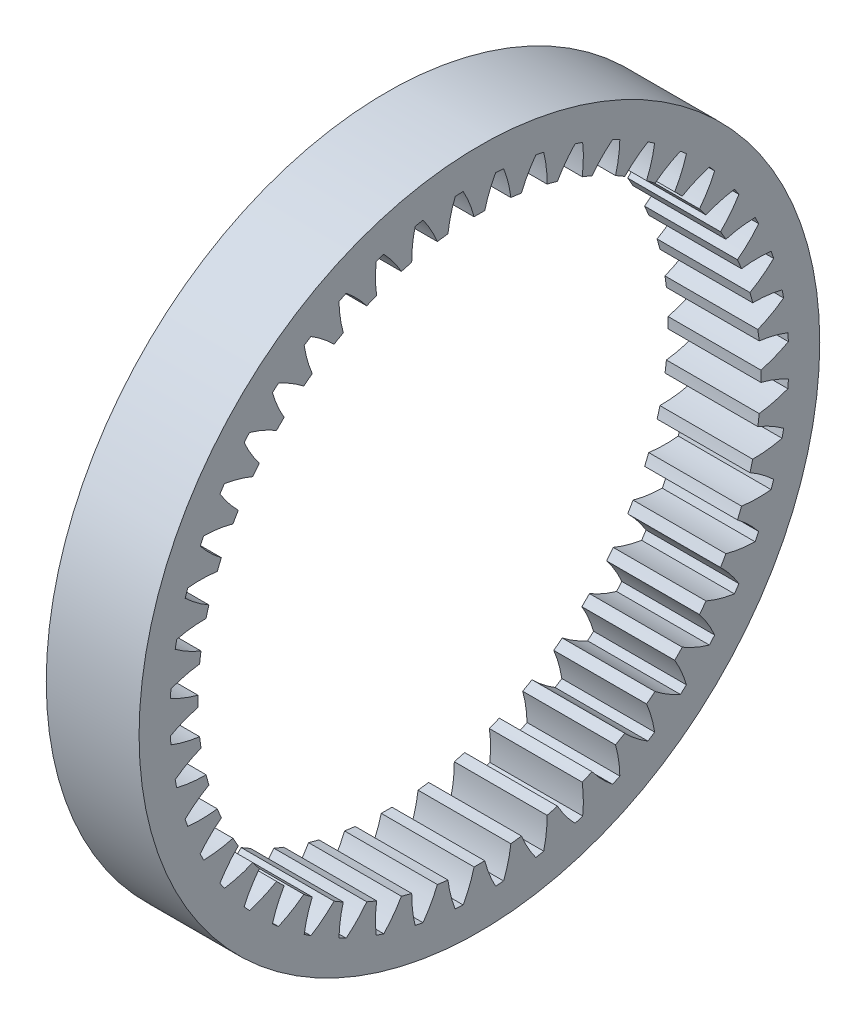
from build123d import *

# Parameters (mm, degrees)
BASPROSKE_W         = 16
BASPROSKE_H         = 50
TOOTHCUT_DEPTH      = 73.498275842
TEETHCUTS_COUNT     = 48
TEETHCUTS_ANGLE     = 352.5
HUBNEABOTSKE_R      = 7.5
HUBNEARBOTH_DEPTH   = 5.5000254
HUBFAR_START        = 5.5000254
HUBFARSKE_R         = 7.5
HUBFAR_DEPTH        = 5.5000254
BORSKE_R            = 5
BORE_DEPTH          = 27.0000508
SKETCH1_R           = 55
BOSS_EXTRUDE1_DEPTH = 15
COMBINE1_START      = -5.5000254
COMBINE1_DEPTH      = 27.0000508


# Read off the part's stored shape, not the designer's step: Combine1
with BuildPart() as part:
    # BasProSke → Base-Revolve (revolve)
    with BuildSketch(Plane(origin=(0, 0, 0), x_dir=(1, 0, 0), z_dir=(0, 1, 0)), mode=Mode.PRIVATE) as base_revolve_sk:
        with Locations((8, 25)):
            Rectangle(BASPROSKE_W, BASPROSKE_H)
    revolve(base_revolve_sk.sketch.rotate(Axis((-10, 0, 0), (1, 0, 0)), 180), axis=Axis((-10, 0, 0), (1, 0, 0)))

    # TooCutSke → ToothCut (cut, through all)
    with BuildSketch(Plane(origin=(0, 0, 0), x_dir=(0, 0, -1), z_dir=(1, 0, 0))):
        with BuildLine():
            ThreePointArc((0.864362355, 45.490788944), (0, 45.499), (-0.864362355, 45.490788944))
            ThreePointArc((-0.864362355, 45.490788944), (-1.610592674, 47.778981572), (-2.637230485, 49.955837102))
            ThreePointArc((-2.637230485, 49.955837102), (0, 50.0254), (2.637230485, 49.955837102))
            ThreePointArc((2.637230485, 49.955837102), (1.610592674, 47.778981572), (0.864362355, 45.490788944))
        make_face()
    toothcut = extrude(amount=TOOTHCUT_DEPTH, mode=Mode.SUBTRACT)

    # TeethCuts: ToothCut ×48 about axis
    teethcuts_axis = Axis((-10, 0, 0), (1, 0, 0))
    for i in range(1, TEETHCUTS_COUNT):
        add(toothcut.rotate(teethcuts_axis, i * TEETHCUTS_ANGLE / (TEETHCUTS_COUNT - 1)), mode=Mode.SUBTRACT)

    # HubNeaBotSke → HubNearBoth (add)
    with BuildSketch(Plane.ZY):
        with Locations(Location((0, 0, 0), (0, 0, 180))):
            Circle(HUBNEABOTSKE_R)
    extrude(amount=HUBNEARBOTH_DEPTH)

    # HubFarSke → HubFar (add)
    with BuildSketch(Plane(origin=(16, 0, 0), x_dir=(0, 0, -1), z_dir=(1, 0, 0)).offset(HUBFAR_START)):
        Circle(HUBFARSKE_R)
    extrude(amount=-HUBFAR_DEPTH)

    # BorSke → Bore (cut, symmetric)
    with BuildSketch(Plane(origin=(0, 0, 0), x_dir=(0, 0, -1), z_dir=(1, 0, 0))):
        with Locations(Location((0, 0, 0), (0, 0, 180))):
            Circle(BORSKE_R)
    extrude(amount=BORE_DEPTH, both=True, mode=Mode.SUBTRACT)


with BuildPart() as body_2:
    # Sketch1 → Boss-Extrude1 (new body)
    with BuildSketch(Plane(origin=(0, 0, 0), x_dir=(0, 0, -1), z_dir=(1, 0, 0))):
        Circle(SKETCH1_R)
    extrude(amount=BOSS_EXTRUDE1_DEPTH)


with BuildPart() as combine1_tool:
    # Combine1 outline → Combine1 (new body)
    with BuildSketch(Plane.YZ.offset(COMBINE1_START)):
        with BuildLine():
            ThreePointArc((3.916123788, 49.846403827), (3.270156461, 49.892946162), (2.623640481, 49.931117658))
            ThreePointArc((2.623640481, 49.931117658), (1.60539254, 47.765870759), (0.864362355, 45.490788944))
            ThreePointArc((0.864362355, 45.490788944), (0, 45.499), (-0.864362355, 45.490788944))
            ThreePointArc((-0.864362355, 45.490788944), (-1.60539254, 47.765870759), (-2.623640481, 49.931117658))
            ThreePointArc((-2.623640481, 49.931117658), (-3.270156461, 49.892946162), (-3.916123788, 49.846403827))
            ThreePointArc((-3.916123788, 49.846403827), (-4.643039044, 47.566772889), (-5.080771847, 45.214430865))
            ThreePointArc((-5.080771847, 45.214430865), (-5.93881122, 45.109749748), (-6.794707077, 44.988787011))
            ThreePointArc((-6.794707077, 44.988787011), (-7.826355412, 47.147681338), (-9.118513534, 49.161496223))
            ThreePointArc((-9.118513534, 49.161496223), (-9.754516101, 49.03926402), (-10.388882094, 48.908804206))
            ThreePointArc((-10.388882094, 48.908804206), (-10.812026943, 46.553794346), (-10.938972634, 44.164441338))
            ThreePointArc((-10.938972634, 44.164441338), (-11.776007733, 43.94865917), (-12.608792477, 43.71701446))
            ThreePointArc((-12.608792477, 43.71701446), (-13.913407174, 45.722782018), (-15.457366293, 47.550707958))
            ThreePointArc((-15.457366293, 47.550707958), (-16.071973265, 47.346506475), (-16.683883746, 47.134361385))
            ThreePointArc((-16.683883746, 47.134361385), (-16.796018063, 44.744267475), (-16.610004566, 42.358785976))
            ThreePointArc((-16.610004566, 42.358785976), (-17.411713489, 42.03559485), (-18.207137942, 41.69723167))
            ThreePointArc((-18.207137942, 41.69723167), (-19.762396681, 43.51555322), (-21.531739228, 45.126313896))
            ThreePointArc((-21.531739228, 45.126313896), (-22.114434511, 44.843637077), (-22.693419522, 44.553436572))
            ThreePointArc((-22.693419522, 44.553436572), (-22.492624657, 42.169153781), (-21.996834714, 39.828360041))
            ThreePointArc((-21.996834714, 39.828360041), (-22.7495, 39.403289847), (-23.493954229, 38.963997686))
            ThreePointArc((-23.493954229, 38.963997686), (-25.273246102, 40.563761242), (-27.237698136, 41.929796091))
            ThreePointArc((-27.237698136, 41.929796091), (-27.778511651, 41.573480615), (-28.314664599, 41.210190107))
            ThreePointArc((-28.314664599, 41.210190107), (-27.804376208, 38.872514175), (-27.007292923, 36.616459823))
            ThreePointArc((-27.007292923, 36.616459823), (-27.698036259, 36.09678363), (-28.378782446, 35.564078899))
            ThreePointArc((-28.378782446, 35.564078899), (-30.351663275, 36.917912062), (-32.477612477, 38.01584785))
            ThreePointArc((-32.477612477, 38.01584785), (-32.967290755, 37.591990374), (-33.451437913, 37.161825864))
            ThreePointArc((-33.451437913, 37.161825864), (-32.640387172, 34.910755075), (-31.555648861, 32.778041826))
            ThreePointArc((-31.555648861, 32.778041826), (-32.172651437, 32.172651437), (-32.778041826, 31.555648861))
            ThreePointArc((-32.778041826, 31.555648861), (-34.910755075, 32.640387172), (-37.161825864, 33.451437913))
            ThreePointArc((-37.161825864, 33.451437913), (-37.591990374, 32.967290755), (-38.01584785, 32.477612477))
            ThreePointArc((-38.01584785, 32.477612477), (-36.917912062, 30.351663275), (-35.564078899, 28.378782446))
            ThreePointArc((-35.564078899, 28.378782446), (-36.09678363, 27.698036259), (-36.616459823, 27.007292923))
            ThreePointArc((-36.616459823, 27.007292923), (-38.872514175, 27.804376208), (-41.210190107, 28.314664599))
            ThreePointArc((-41.210190107, 28.314664599), (-41.573480615, 27.778511651), (-41.929796091, 27.237698136))
            ThreePointArc((-41.929796091, 27.237698136), (-40.563761242, 25.273246102), (-38.963997686, 23.493954229))
            ThreePointArc((-38.963997686, 23.493954229), (-39.403289847, 22.7495), (-39.828360041, 21.996834714))
            ThreePointArc((-39.828360041, 21.996834714), (-42.169153781, 22.492624657), (-44.553436572, 22.693419522))
            ThreePointArc((-44.553436572, 22.693419522), (-44.843637077, 22.114434511), (-45.126313896, 21.531739228))
            ThreePointArc((-45.126313896, 21.531739228), (-43.51555322, 19.762396681), (-41.69723167, 18.207137942))
            ThreePointArc((-41.69723167, 18.207137942), (-42.03559485, 17.411713489), (-42.358785976, 16.610004566))
            ThreePointArc((-42.358785976, 16.610004566), (-44.744267475, 16.796018063), (-47.134361385, 16.683883746))
            ThreePointArc((-47.134361385, 16.683883746), (-47.346506475, 16.071973265), (-47.550707958, 15.457366293))
            ThreePointArc((-47.550707958, 15.457366293), (-45.722782018, 13.913407174), (-43.71701446, 12.608792477))
            ThreePointArc((-43.71701446, 12.608792477), (-43.94865917, 11.776007733), (-44.164441338, 10.938972634))
            ThreePointArc((-44.164441338, 10.938972634), (-46.553794346, 10.812026943), (-48.908804206, 10.388882094))
            ThreePointArc((-48.908804206, 10.388882094), (-49.03926402, 9.754516101), (-49.161496223, 9.118513534))
            ThreePointArc((-49.161496223, 9.118513534), (-47.147681338, 7.826355412), (-44.988787011, 6.794707077))
            ThreePointArc((-44.988787011, 6.794707077), (-45.109749748, 5.93881122), (-45.214430865, 5.080771847))
            ThreePointArc((-45.214430865, 5.080771847), (-47.566772889, 4.643039044), (-49.846403827, 3.916123788))
            ThreePointArc((-49.846403827, 3.916123788), (-49.892946162, 3.270156461), (-49.931117658, 2.623640481))
            ThreePointArc((-49.931117658, 2.623640481), (-47.765870759, 1.60539254), (-45.490788944, 0.864362355))
            ThreePointArc((-45.490788944, 0.864362355), (-45.499, 0), (-45.490788944, -0.864362355))
            ThreePointArc((-45.490788944, -0.864362355), (-47.765870759, -1.60539254), (-49.931117658, -2.623640481))
            ThreePointArc((-49.931117658, -2.623640481), (-49.892946162, -3.270156461), (-49.846403827, -3.916123788))
            ThreePointArc((-49.846403827, -3.916123788), (-47.566772889, -4.643039044), (-45.214430865, -5.080771847))
            ThreePointArc((-45.214430865, -5.080771847), (-45.109749748, -5.93881122), (-44.988787011, -6.794707077))
            ThreePointArc((-44.988787011, -6.794707077), (-47.147681338, -7.826355412), (-49.161496223, -9.118513534))
            ThreePointArc((-49.161496223, -9.118513534), (-49.03926402, -9.754516101), (-48.908804206, -10.388882094))
            ThreePointArc((-48.908804206, -10.388882094), (-46.553794346, -10.812026943), (-44.164441338, -10.938972634))
            ThreePointArc((-44.164441338, -10.938972634), (-43.94865917, -11.776007733), (-43.71701446, -12.608792477))
            ThreePointArc((-43.71701446, -12.608792477), (-45.722782018, -13.913407174), (-47.550707958, -15.457366293))
            ThreePointArc((-47.550707958, -15.457366293), (-47.346506475, -16.071973265), (-47.134361385, -16.683883746))
            ThreePointArc((-47.134361385, -16.683883746), (-44.744267475, -16.796018063), (-42.358785976, -16.610004566))
            ThreePointArc((-42.358785976, -16.610004566), (-42.03559485, -17.411713489), (-41.69723167, -18.207137942))
            ThreePointArc((-41.69723167, -18.207137942), (-43.51555322, -19.762396681), (-45.126313896, -21.531739228))
            ThreePointArc((-45.126313896, -21.531739228), (-44.843637077, -22.114434511), (-44.553436572, -22.693419522))
            ThreePointArc((-44.553436572, -22.693419522), (-42.169153781, -22.492624657), (-39.828360041, -21.996834714))
            ThreePointArc((-39.828360041, -21.996834714), (-39.403289847, -22.7495), (-38.963997686, -23.493954229))
            ThreePointArc((-38.963997686, -23.493954229), (-40.563761242, -25.273246102), (-41.929796091, -27.237698136))
            ThreePointArc((-41.929796091, -27.237698136), (-41.573480615, -27.778511651), (-41.210190107, -28.314664599))
            ThreePointArc((-41.210190107, -28.314664599), (-38.872514175, -27.804376208), (-36.616459823, -27.007292923))
            ThreePointArc((-36.616459823, -27.007292923), (-36.09678363, -27.698036259), (-35.564078899, -28.378782446))
            ThreePointArc((-35.564078899, -28.378782446), (-36.917912062, -30.351663275), (-38.01584785, -32.477612477))
            ThreePointArc((-38.01584785, -32.477612477), (-37.591990374, -32.967290755), (-37.161825864, -33.451437913))
            ThreePointArc((-37.161825864, -33.451437913), (-34.910755075, -32.640387172), (-32.778041826, -31.555648861))
            ThreePointArc((-32.778041826, -31.555648861), (-32.172651437, -32.172651437), (-31.555648861, -32.778041826))
            ThreePointArc((-31.555648861, -32.778041826), (-32.640387172, -34.910755075), (-33.451437913, -37.161825864))
            ThreePointArc((-33.451437913, -37.161825864), (-32.967290755, -37.591990374), (-32.477612477, -38.01584785))
            ThreePointArc((-32.477612477, -38.01584785), (-30.351663275, -36.917912062), (-28.378782446, -35.564078899))
            ThreePointArc((-28.378782446, -35.564078899), (-27.698036259, -36.09678363), (-27.007292923, -36.616459823))
            ThreePointArc((-27.007292923, -36.616459823), (-27.804376208, -38.872514175), (-28.314664599, -41.210190107))
            ThreePointArc((-28.314664599, -41.210190107), (-27.778511651, -41.573480615), (-27.237698136, -41.929796091))
            ThreePointArc((-27.237698136, -41.929796091), (-25.273246102, -40.563761242), (-23.493954229, -38.963997686))
            ThreePointArc((-23.493954229, -38.963997686), (-22.7495, -39.403289847), (-21.996834714, -39.828360041))
            ThreePointArc((-21.996834714, -39.828360041), (-22.492624657, -42.169153781), (-22.693419522, -44.553436572))
            ThreePointArc((-22.693419522, -44.553436572), (-22.114434511, -44.843637077), (-21.531739228, -45.126313896))
            ThreePointArc((-21.531739228, -45.126313896), (-19.762396681, -43.51555322), (-18.207137942, -41.69723167))
            ThreePointArc((-18.207137942, -41.69723167), (-17.411713489, -42.03559485), (-16.610004566, -42.358785976))
            ThreePointArc((-16.610004566, -42.358785976), (-16.796018063, -44.744267475), (-16.683883746, -47.134361385))
            ThreePointArc((-16.683883746, -47.134361385), (-16.071973265, -47.346506475), (-15.457366293, -47.550707958))
            ThreePointArc((-15.457366293, -47.550707958), (-13.913407174, -45.722782018), (-12.608792477, -43.71701446))
            ThreePointArc((-12.608792477, -43.71701446), (-11.776007733, -43.94865917), (-10.938972634, -44.164441338))
            ThreePointArc((-10.938972634, -44.164441338), (-10.812026943, -46.553794346), (-10.388882094, -48.908804206))
            ThreePointArc((-10.388882094, -48.908804206), (-9.754516101, -49.03926402), (-9.118513534, -49.161496223))
            ThreePointArc((-9.118513534, -49.161496223), (-7.826355412, -47.147681338), (-6.794707077, -44.988787011))
            ThreePointArc((-6.794707077, -44.988787011), (-5.93881122, -45.109749748), (-5.080771847, -45.214430865))
            ThreePointArc((-5.080771847, -45.214430865), (-4.643039044, -47.566772889), (-3.916123788, -49.846403827))
            ThreePointArc((-3.916123788, -49.846403827), (-3.270156461, -49.892946162), (-2.623640481, -49.931117658))
            ThreePointArc((-2.623640481, -49.931117658), (-1.60539254, -47.765870759), (-0.864362355, -45.490788944))
            ThreePointArc((-0.864362355, -45.490788944), (0, -45.499), (0.864362355, -45.490788944))
            ThreePointArc((0.864362355, -45.490788944), (1.60539254, -47.765870759), (2.623640481, -49.931117658))
            ThreePointArc((2.623640481, -49.931117658), (3.270156461, -49.892946162), (3.916123788, -49.846403827))
            ThreePointArc((3.916123788, -49.846403827), (4.643039044, -47.566772889), (5.080771847, -45.214430865))
            ThreePointArc((5.080771847, -45.214430865), (5.93881122, -45.109749748), (6.794707077, -44.988787011))
            ThreePointArc((6.794707077, -44.988787011), (7.826355412, -47.147681338), (9.118513534, -49.161496223))
            ThreePointArc((9.118513534, -49.161496223), (9.754516101, -49.03926402), (10.388882094, -48.908804206))
            ThreePointArc((10.388882094, -48.908804206), (10.812026943, -46.553794346), (10.938972634, -44.164441338))
            ThreePointArc((10.938972634, -44.164441338), (11.776007733, -43.94865917), (12.608792477, -43.71701446))
            ThreePointArc((12.608792477, -43.71701446), (13.913407174, -45.722782018), (15.457366293, -47.550707958))
            ThreePointArc((15.457366293, -47.550707958), (16.071973265, -47.346506475), (16.683883746, -47.134361385))
            ThreePointArc((16.683883746, -47.134361385), (16.796018063, -44.744267475), (16.610004566, -42.358785976))
            ThreePointArc((16.610004566, -42.358785976), (17.411713489, -42.03559485), (18.207137942, -41.69723167))
            ThreePointArc((18.207137942, -41.69723167), (19.762396681, -43.51555322), (21.531739228, -45.126313896))
            ThreePointArc((21.531739228, -45.126313896), (22.114434511, -44.843637077), (22.693419522, -44.553436572))
            ThreePointArc((22.693419522, -44.553436572), (22.492624657, -42.169153781), (21.996834714, -39.828360041))
            ThreePointArc((21.996834714, -39.828360041), (22.7495, -39.403289847), (23.493954229, -38.963997686))
            ThreePointArc((23.493954229, -38.963997686), (25.273246102, -40.563761242), (27.237698136, -41.929796091))
            ThreePointArc((27.237698136, -41.929796091), (27.778511651, -41.573480615), (28.314664599, -41.210190107))
            ThreePointArc((28.314664599, -41.210190107), (27.804376208, -38.872514175), (27.007292923, -36.616459823))
            ThreePointArc((27.007292923, -36.616459823), (27.698036259, -36.09678363), (28.378782446, -35.564078899))
            ThreePointArc((28.378782446, -35.564078899), (30.351663275, -36.917912062), (32.477612477, -38.01584785))
            ThreePointArc((32.477612477, -38.01584785), (32.967290755, -37.591990374), (33.451437913, -37.161825864))
            ThreePointArc((33.451437913, -37.161825864), (32.640387172, -34.910755075), (31.555648861, -32.778041826))
            ThreePointArc((31.555648861, -32.778041826), (32.172651437, -32.172651437), (32.778041826, -31.555648861))
            ThreePointArc((32.778041826, -31.555648861), (34.910755075, -32.640387172), (37.161825864, -33.451437913))
            ThreePointArc((37.161825864, -33.451437913), (37.591990374, -32.967290755), (38.01584785, -32.477612477))
            ThreePointArc((38.01584785, -32.477612477), (36.917912062, -30.351663275), (35.564078899, -28.378782446))
            ThreePointArc((35.564078899, -28.378782446), (36.09678363, -27.698036259), (36.616459823, -27.007292923))
            ThreePointArc((36.616459823, -27.007292923), (38.872514175, -27.804376208), (41.210190107, -28.314664599))
            ThreePointArc((41.210190107, -28.314664599), (41.573480615, -27.778511651), (41.929796091, -27.237698136))
            ThreePointArc((41.929796091, -27.237698136), (40.563761242, -25.273246102), (38.963997686, -23.493954229))
            ThreePointArc((38.963997686, -23.493954229), (39.403289847, -22.7495), (39.828360041, -21.996834714))
            ThreePointArc((39.828360041, -21.996834714), (42.169153781, -22.492624657), (44.553436572, -22.693419522))
            ThreePointArc((44.553436572, -22.693419522), (44.843637077, -22.114434511), (45.126313896, -21.531739228))
            ThreePointArc((45.126313896, -21.531739228), (43.51555322, -19.762396681), (41.69723167, -18.207137942))
            ThreePointArc((41.69723167, -18.207137942), (42.03559485, -17.411713489), (42.358785976, -16.610004566))
            ThreePointArc((42.358785976, -16.610004566), (44.744267475, -16.796018063), (47.134361385, -16.683883746))
            ThreePointArc((47.134361385, -16.683883746), (47.346506475, -16.071973265), (47.550707958, -15.457366293))
            ThreePointArc((47.550707958, -15.457366293), (45.722782018, -13.913407174), (43.71701446, -12.608792477))
            ThreePointArc((43.71701446, -12.608792477), (43.94865917, -11.776007733), (44.164441338, -10.938972634))
            ThreePointArc((44.164441338, -10.938972634), (46.553794346, -10.812026943), (48.908804206, -10.388882094))
            ThreePointArc((48.908804206, -10.388882094), (49.03926402, -9.754516101), (49.161496223, -9.118513534))
            ThreePointArc((49.161496223, -9.118513534), (47.147681338, -7.826355412), (44.988787011, -6.794707077))
            ThreePointArc((44.988787011, -6.794707077), (45.109749748, -5.93881122), (45.214430865, -5.080771847))
            ThreePointArc((45.214430865, -5.080771847), (47.566772889, -4.643039044), (49.846403827, -3.916123788))
            ThreePointArc((49.846403827, -3.916123788), (49.892946162, -3.270156461), (49.931117658, -2.623640481))
            ThreePointArc((49.931117658, -2.623640481), (47.765870759, -1.60539254), (45.490788944, -0.864362355))
            ThreePointArc((45.490788944, -0.864362355), (45.499, 0), (45.490788944, 0.864362355))
            ThreePointArc((45.490788944, 0.864362355), (47.765870759, 1.60539254), (49.931117658, 2.623640481))
            ThreePointArc((49.931117658, 2.623640481), (49.892946162, 3.270156461), (49.846403827, 3.916123788))
            ThreePointArc((49.846403827, 3.916123788), (47.566772889, 4.643039044), (45.214430865, 5.080771847))
            ThreePointArc((45.214430865, 5.080771847), (45.109749748, 5.93881122), (44.988787011, 6.794707077))
            ThreePointArc((44.988787011, 6.794707077), (47.147681338, 7.826355412), (49.161496223, 9.118513534))
            ThreePointArc((49.161496223, 9.118513534), (49.03926402, 9.754516101), (48.908804206, 10.388882094))
            ThreePointArc((48.908804206, 10.388882094), (46.553794346, 10.812026943), (44.164441338, 10.938972634))
            ThreePointArc((44.164441338, 10.938972634), (43.94865917, 11.776007733), (43.71701446, 12.608792477))
            ThreePointArc((43.71701446, 12.608792477), (45.722782018, 13.913407174), (47.550707958, 15.457366293))
            ThreePointArc((47.550707958, 15.457366293), (47.346506475, 16.071973265), (47.134361385, 16.683883746))
            ThreePointArc((47.134361385, 16.683883746), (44.744267475, 16.796018063), (42.358785976, 16.610004566))
            ThreePointArc((42.358785976, 16.610004566), (42.03559485, 17.411713489), (41.69723167, 18.207137942))
            ThreePointArc((41.69723167, 18.207137942), (43.51555322, 19.762396681), (45.126313896, 21.531739228))
            ThreePointArc((45.126313896, 21.531739228), (44.843637077, 22.114434511), (44.553436572, 22.693419522))
            ThreePointArc((44.553436572, 22.693419522), (42.169153781, 22.492624657), (39.828360041, 21.996834714))
            ThreePointArc((39.828360041, 21.996834714), (39.403289847, 22.7495), (38.963997686, 23.493954229))
            ThreePointArc((38.963997686, 23.493954229), (40.563761242, 25.273246102), (41.929796091, 27.237698136))
            ThreePointArc((41.929796091, 27.237698136), (41.573480615, 27.778511651), (41.210190107, 28.314664599))
            ThreePointArc((41.210190107, 28.314664599), (38.872514175, 27.804376208), (36.616459823, 27.007292923))
            ThreePointArc((36.616459823, 27.007292923), (36.09678363, 27.698036259), (35.564078899, 28.378782446))
            ThreePointArc((35.564078899, 28.378782446), (36.917912062, 30.351663275), (38.01584785, 32.477612477))
            ThreePointArc((38.01584785, 32.477612477), (37.591990374, 32.967290755), (37.161825864, 33.451437913))
            ThreePointArc((37.161825864, 33.451437913), (34.910755075, 32.640387172), (32.778041826, 31.555648861))
            ThreePointArc((32.778041826, 31.555648861), (32.172651437, 32.172651437), (31.555648861, 32.778041826))
            ThreePointArc((31.555648861, 32.778041826), (32.640387172, 34.910755075), (33.451437913, 37.161825864))
            ThreePointArc((33.451437913, 37.161825864), (32.967290755, 37.591990374), (32.477612477, 38.01584785))
            ThreePointArc((32.477612477, 38.01584785), (30.351663275, 36.917912062), (28.378782446, 35.564078899))
            ThreePointArc((28.378782446, 35.564078899), (27.698036259, 36.09678363), (27.007292923, 36.616459823))
            ThreePointArc((27.007292923, 36.616459823), (27.804376208, 38.872514175), (28.314664599, 41.210190107))
            ThreePointArc((28.314664599, 41.210190107), (27.778511651, 41.573480615), (27.237698136, 41.929796091))
            ThreePointArc((27.237698136, 41.929796091), (25.273246102, 40.563761242), (23.493954229, 38.963997686))
            ThreePointArc((23.493954229, 38.963997686), (22.7495, 39.403289847), (21.996834714, 39.828360041))
            ThreePointArc((21.996834714, 39.828360041), (22.492624657, 42.169153781), (22.693419522, 44.553436572))
            ThreePointArc((22.693419522, 44.553436572), (22.114434511, 44.843637077), (21.531739228, 45.126313896))
            ThreePointArc((21.531739228, 45.126313896), (19.762396681, 43.51555322), (18.207137942, 41.69723167))
            ThreePointArc((18.207137942, 41.69723167), (17.411713489, 42.03559485), (16.610004566, 42.358785976))
            ThreePointArc((16.610004566, 42.358785976), (16.796018063, 44.744267475), (16.683883746, 47.134361385))
            ThreePointArc((16.683883746, 47.134361385), (16.071973265, 47.346506475), (15.457366293, 47.550707958))
            ThreePointArc((15.457366293, 47.550707958), (13.913407174, 45.722782018), (12.608792477, 43.71701446))
            ThreePointArc((12.608792477, 43.71701446), (11.776007733, 43.94865917), (10.938972634, 44.164441338))
            ThreePointArc((10.938972634, 44.164441338), (10.812026943, 46.553794346), (10.388882094, 48.908804206))
            ThreePointArc((10.388882094, 48.908804206), (9.754516101, 49.03926402), (9.118513534, 49.161496223))
            ThreePointArc((9.118513534, 49.161496223), (7.826355412, 47.147681338), (6.794707077, 44.988787011))
            ThreePointArc((6.794707077, 44.988787011), (5.93881122, 45.109749748), (5.080771847, 45.214430865))
            ThreePointArc((5.080771847, 45.214430865), (4.643039044, 47.566772889), (3.916123788, 49.846403827))
        make_face()
    extrude(amount=COMBINE1_DEPTH)


with BuildPart() as part_1:
    add(part.part)

    # Combine1: cut by combine1_tool
    add(combine1_tool.part, mode=Mode.SUBTRACT)


with BuildPart() as body_2_1:
    add(body_2.part)

    # Combine1: cut by combine1_tool
    add(combine1_tool.part, mode=Mode.SUBTRACT)


solid = body_2_1.part
